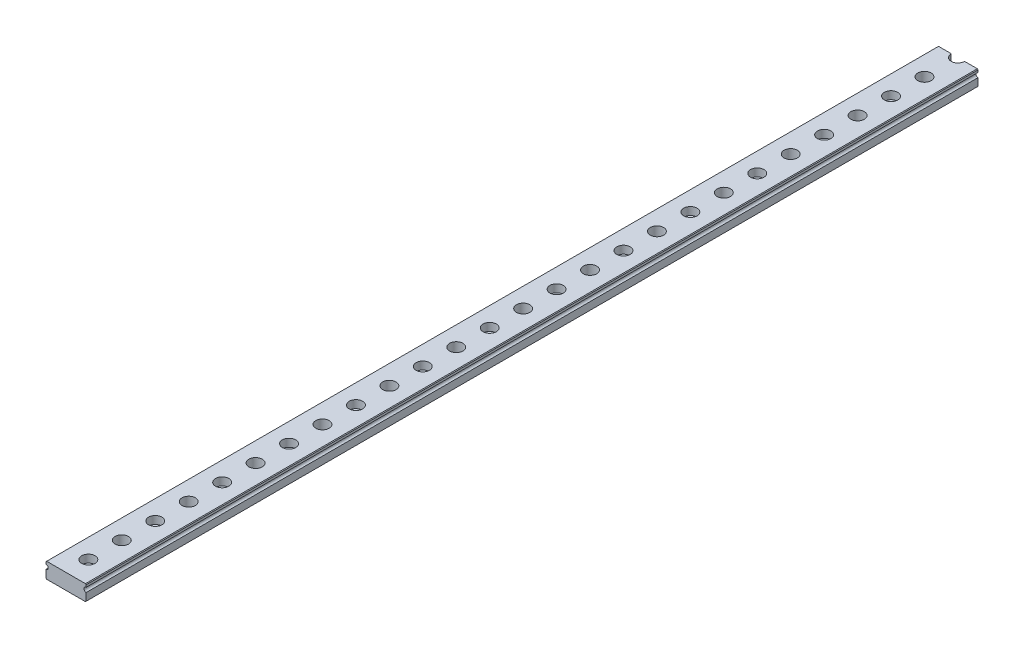
from build123d import *

# Parameters (mm, degrees)
ESBO_O1_W                                            = 18
ESBO_O1_H                                            = 400
RESSALTO_EXTRUS_O1_DEPTH                             = 7
FURO_DE_DI_METRO_2_0_2_1_D                           = 2
FURO_DE_DI_METRO_6_0_6_1_D                           = 6
REBAIXO_PARA_PARAFUSO_DE_M_QUINA_DE_CABE_D           = 3.5
REBAIXO_PARA_PARAFUSO_DE_M_QUINA_DE_CABE_CBORE_D     = 6
REBAIXO_PARA_PARAFUSO_DE_M_QUINA_DE_CABE_CBORE_DEPTH = 3.5
PADR_O_LINEAR1_COUNT                                 = 13
PADR_O_LINEAR1_PITCH                                 = 30
PADR_O_LINEAR2_COUNT                                 = 14
PADR_O_LINEAR2_PITCH                                 = 30
CHANFRO1_SIZE                                        = 0.3


with BuildPart() as part:
    # Esboço1 → Ressalto-extrusão1 (new body)
    with BuildSketch(Plane.XZ):
        with Locations((-9, -200)):
            Rectangle(ESBO_O1_W, ESBO_O1_H)
    extrude(amount=-RESSALTO_EXTRUS_O1_DEPTH)

    # Furo de diâmetro Ø2.0 (2)1 (through all)
    with Locations(Plane(origin=(0, 0, -400), x_dir=(-1, 0, 0), z_dir=(0, 0, -1))):
        with Locations((0, 4.7), (18, 4.7)):
            Hole(FURO_DE_DI_METRO_2_0_2_1_D / 2)

    # Furo de diâmetro Ø6.0 (6)1 (through all)
    with Locations(Plane(origin=(0, 7, 0), x_dir=(1, 0, 0), z_dir=(0, 1, 0))):
        with Locations((-9, 25)):
            furo_de_di_metro_6_0_6_1 = Hole(FURO_DE_DI_METRO_6_0_6_1_D / 2)

    # Rebaixo para parafuso de máquina de cabeça sextavada de M31 (through all)
    with Locations(Plane(origin=(0, 7, 0), x_dir=(1, 0, 0), z_dir=(0, 1, 0))):
        with Locations((-9, 10)):
            rebaixo_para_parafuso_de_m_quina_de_cabe = CounterBoreHole(REBAIXO_PARA_PARAFUSO_DE_M_QUINA_DE_CABE_D / 2, REBAIXO_PARA_PARAFUSO_DE_M_QUINA_DE_CABE_CBORE_D / 2, REBAIXO_PARA_PARAFUSO_DE_M_QUINA_DE_CABE_CBORE_DEPTH)

    # Padrão linear1: Furo de diâmetro Ø6.0 (6)1 ×13
    with Locations(*[(0, 0, -i * PADR_O_LINEAR1_PITCH) for i in range(1, PADR_O_LINEAR1_COUNT)]):
        add(furo_de_di_metro_6_0_6_1, mode=Mode.SUBTRACT)

    # Padrão linear2: Rebaixo para parafuso de máquina de cabeça sextavada de M31 ×14
    with Locations(*[(0, 0, -i * PADR_O_LINEAR2_PITCH) for i in range(1, PADR_O_LINEAR2_COUNT)]):
        add(rebaixo_para_parafuso_de_m_quina_de_cabe, mode=Mode.SUBTRACT)

    # Chanfro1
    chanfro1_edges = [part.edges().sort_by_distance(p)[0] for p in [
        (-18, 7, -200),
        (0, 7, -200),
        (0, 0, -200),
        (-18, 0, -200),
    ]]
    chamfer(chanfro1_edges, length=CHANFRO1_SIZE)


solid = part.part
